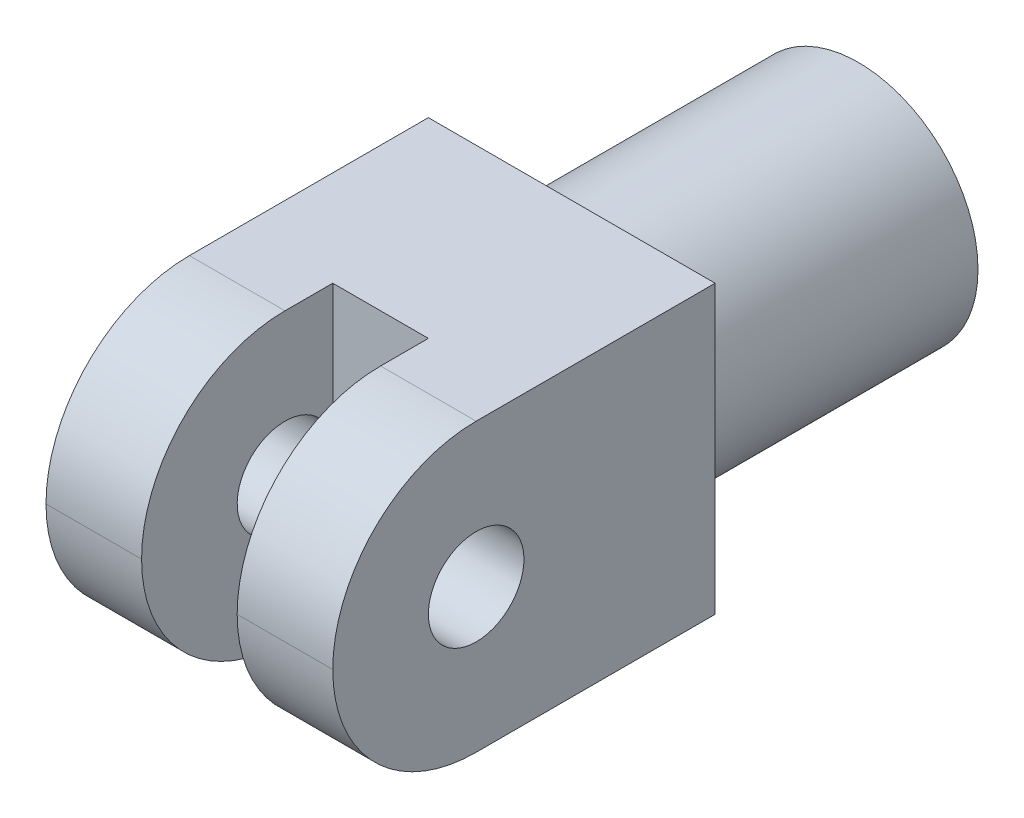
from build123d import *

# Parameters (mm, degrees)
SKETCH2_R           = 12.5
BOSS_EXTRUDE1_DEPTH = 30
SKETCH3_W           = 30
SKETCH3_H           = 30
BOSS_EXTRUDE2_DEPTH = 40
SKETCH4_W           = 10
SKETCH4_H           = 20
CUT_EXTRUDE1_DEPTH  = 40
FILLET1_R           = 15
SKETCH5_R           = 5
CUT_EXTRUDE2_DEPTH  = 40


with BuildPart() as part:
    # Sketch2 → Boss-Extrude1 (new body)
    with BuildSketch(Plane.XY):
        Circle(SKETCH2_R)
    extrude(amount=BOSS_EXTRUDE1_DEPTH)

    # Sketch3 → Boss-Extrude2 (add)
    with BuildSketch(Plane.XY.offset(30)):
        Rectangle(SKETCH3_W, SKETCH3_H)
    extrude(amount=BOSS_EXTRUDE2_DEPTH)

    # Sketch4 → Cut-Extrude1 (cut)
    with BuildSketch(Plane(origin=(0, 15, 0), x_dir=(1, 0, 0), z_dir=(0, 1, 0))):
        with Locations((0, -60)):
            Rectangle(SKETCH4_W, SKETCH4_H)
    extrude(amount=-CUT_EXTRUDE1_DEPTH, mode=Mode.SUBTRACT)

    # Fillet1
    fillet1_edges = [part.edges().sort_by_distance(p)[0] for p in [
        (10, 15, 70),
        (10, -15, 70),
        (-10, -15, 70),
        (-10, 15, 70),
    ]]
    fillet(fillet1_edges, radius=FILLET1_R - 0.0001)  # a hair under: the kernel refuses the full size

    # Sketch5 → Cut-Extrude2 (cut)
    with BuildSketch(Plane.ZY.offset(15)):
        with Locations(Location((55, 0, 0), (0, 0, 270))):
            Circle(SKETCH5_R)
    extrude(amount=-CUT_EXTRUDE2_DEPTH, mode=Mode.SUBTRACT)


solid = part.part
